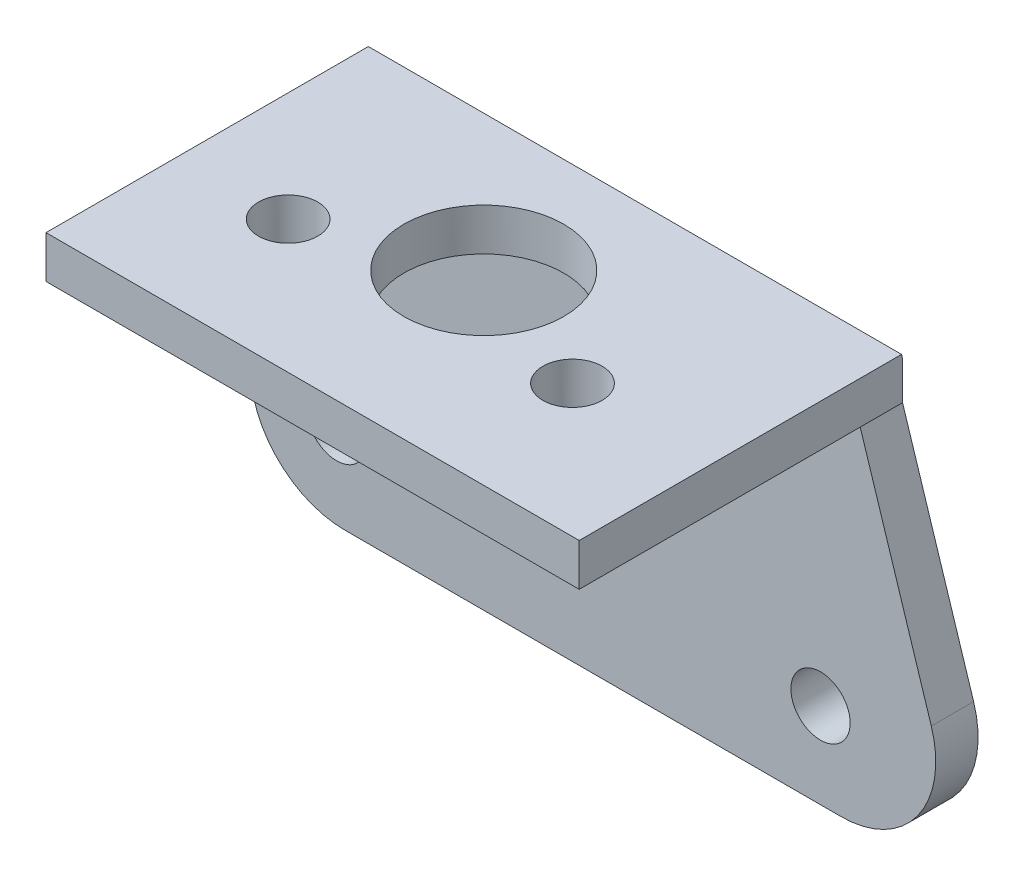
from build123d import *

# Parameters (mm, degrees)
BOSS_EXTRUDE1_DEPTH              = 3.571875
SKETCH2_W                        = 45
SKETCH2_H                        = 3.571875
BOSS_EXTRUDE2_DEPTH              = 23.714964
F_5_0_5_DIAMETER_HOLE1_D         = 5
F_5_0_5_DIAMETER_HOLE1_DEPTH     = 27.286839
FILLET1_R                        = 2
F_13_5_13_5_DIAMETER_HOLE1_D     = 13.5
F_13_5_13_5_DIAMETER_HOLE1_DEPTH = 34.276761893
F_5_0_5_DIAMETER_HOLE2_D         = 5
F_5_0_5_DIAMETER_HOLE2_DEPTH     = 34.276761893
SKETCH9_W                        = 45
SKETCH9_H                        = 1.428125
CUT_EXTRUDE1_DEPTH               = 10


with BuildPart() as part:
    # Sketch1 → Boss-Extrude1 (new body)
    with BuildSketch(Plane.XY.offset(5)):
        with BuildLine():
            Line((-21.229980824, 0), (-27.336443266, -18.80609256))
            ThreePointArc((-27.336443266, -18.80609256), (-26.199197486, -25.979667662), (-19.727514758, -29.276761893))
            Line((-19.727514758, -29.276761893), (22.145905459, -29.276761893))
            ThreePointArc((22.145905459, -29.276761893), (28.60379109, -25.99859556), (29.769170906, -18.850690187))
            Line((29.769170906, -18.850690187), (23.770019176, 0))
            Line((23.770019176, 0), (23.770019176, 5))
            Line((23.770019176, 5), (-21.229980824, 5))
            Line((-21.229980824, 5), (-21.229980824, 0))
        make_face()
    extrude(amount=-BOSS_EXTRUDE1_DEPTH)

    # Sketch2 → Boss-Extrude2 (add)
    with BuildSketch(Plane.XY.offset(5)):
        with Locations((1.270019176, 1.7859375)):
            Rectangle(SKETCH2_W, SKETCH2_H)
    extrude(amount=BOSS_EXTRUDE2_DEPTH)

    # Ø5.0 (5) Diameter Hole1
    with Locations(Plane(origin=(0, 0, 1.428125), x_dir=(-1, 0, 0), z_dir=(0, 0, -1))):
        with Locations((-20.42, -22.057021037), (20.42, -22.057021037)):
            Hole(F_5_0_5_DIAMETER_HOLE1_D / 2, depth=F_5_0_5_DIAMETER_HOLE1_DEPTH)

    # Fillet1
    fillet1_edges = [part.edges().sort_by_distance(p)[0] for p in [
        (1.270019176, 5, 1.428125),
    ]]
    fillet(fillet1_edges, radius=FILLET1_R)

    # Ø13.5 (13.5) Diameter Hole1
    with Locations(Plane(origin=(0, 5, 0), x_dir=(1, 0, 0), z_dir=(0, 1, 0))):
        with Locations((0, -13)):
            Hole(F_13_5_13_5_DIAMETER_HOLE1_D / 2, depth=F_13_5_13_5_DIAMETER_HOLE1_DEPTH)

    # Ø5.0 (5) Diameter Hole2
    with Locations(Plane(origin=(0, 5, 0), x_dir=(1, 0, 0), z_dir=(0, 1, 0))):
        with Locations((-12, -17.51), (12, -17.51)):
            Hole(F_5_0_5_DIAMETER_HOLE2_D / 2, depth=F_5_0_5_DIAMETER_HOLE2_DEPTH)

    # Sketch9 → Cut-Extrude1 (cut)
    with BuildSketch(Plane.XY.offset(5)):
        with Locations((1.270019176, 4.2859375)):
            Rectangle(SKETCH9_W, SKETCH9_H)
    extrude(amount=-CUT_EXTRUDE1_DEPTH, mode=Mode.SUBTRACT)


solid = part.part
